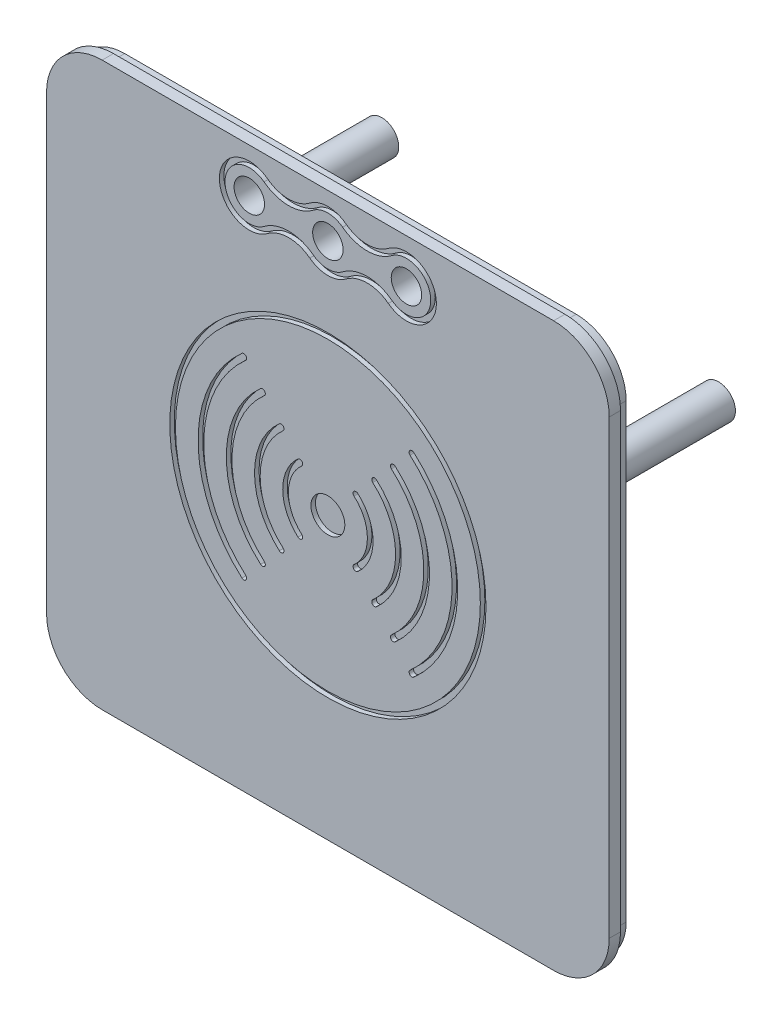
from build123d import *
from OCP.BRepFilletAPI import BRepFilletAPI_MakeChamfer

# Parameters (mm, degrees)
SALIENTE_EXTRUIR1_DEPTH = 2
SALIENTE_EXTRUIR2_DEPTH = 2
CORTAR_EXTRUIR1_DEPTH   = 2
CROQUIS5_R              = 28.015207884
CROQUIS5_R_2            = 27.015207884
CROQUIS5_R_3            = 3
CORTAR_EXTRUIR2_DEPTH   = 0.8
CROQUIS6_R              = 2.7
CORTAR_EXTRUIR3_DEPTH   = 11.8
CROQUIS7_R              = 3
SALIENTE_EXTRUIR3_DEPTH = 31.34
CROQUIS8_R              = 2
CORTAR_EXTRUIR4_DEPTH   = 5
CROQUIS9_W              = 20.569885585
CROQUIS9_H              = 2.86791674
CORTAR_EXTRUIR5_DEPTH   = 1
CROQUIS10_W             = 0.685574001
CROQUIS10_H             = 8.330017526
CROQUIS10_W_2           = 0.70136351
SALIENTE_EXTRUIR4_DEPTH = 1
CROQUIS11_W             = 1.000377771
CROQUIS11_H             = 8.330017526
SALIENTE_EXTRUIR5_DEPTH = 0.3
CROQUIS12_W             = 1.006924042
CROQUIS12_H             = 8.323274802
SALIENTE_EXTRUIR6_DEPTH = 0.5
CHAFL_N1_SIZE           = 0.310659094
CHAFL_N1_SIZE_2         = 0.3
CORTAR_EXTRUIR6_DEPTH   = 0.8


with BuildPart() as part:
    # Croquis1 → Saliente-Extruir1 (new body)
    with BuildSketch(Plane.XY):
        with BuildLine():
            Line((-24.066972173, 40), (-24.066972173, -40))
            ThreePointArc((-24.066972173, -40), (-21.181973968, -46.965001795), (-14.216972173, -49.85))
            Line((-14.216972173, -49.85), (65.783027827, -49.85))
            ThreePointArc((65.783027827, -49.85), (72.748029622, -46.965001795), (75.633027827, -40))
            Line((75.633027827, -40), (75.633027827, 40))
            ThreePointArc((75.633027827, 40), (72.748029622, 46.965001795), (65.783027827, 49.85))
            Line((65.783027827, 49.85), (-14.216972173, 49.85))
            ThreePointArc((-14.216972173, 49.85), (-21.181973968, 46.965001795), (-24.066972173, 40))
        make_face()
    extrude(amount=SALIENTE_EXTRUIR1_DEPTH)

    # Croquis2 → Saliente-Extruir2 (add)
    with BuildSketch(Plane(origin=(0, 0, 0), x_dir=(-1, 0, 0), z_dir=(0, 0, -1))):
        with BuildLine():
            Line((14.216972173, 48.85), (-65.783027827, 48.85))
            ThreePointArc((-65.783027827, 48.85), (-72.040922841, 46.257895014), (-74.633027827, 40))
            Line((-74.633027827, 40), (-74.633027827, -40))
            ThreePointArc((-74.633027827, -40), (-72.040922841, -46.257895014), (-65.783027827, -48.85))
            Line((-65.783027827, -48.85), (14.216972173, -48.85))
            ThreePointArc((14.216972173, -48.85), (20.474867186, -46.257895014), (23.066972173, -40))
            Line((23.066972173, -40), (23.066972173, 40))
            ThreePointArc((23.066972173, 40), (20.474867186, 46.257895014), (14.216972173, 48.85))
        make_face()
    extrude(amount=SALIENTE_EXTRUIR2_DEPTH)

    # Croquis3 → Cortar-Extruir1 (cut)
    with BuildSketch(Plane(origin=(0, 0, -2), x_dir=(-1, 0, 0), z_dir=(0, 0, -1))):
        Polygon((-5.783027827, 0), (-5.783027827, -40), (-45.783027827, -40), (-45.783027827, 0), (-45.783027827, 20.3), (-5.783027827, 20.3), align=None)
    extrude(amount=-CORTAR_EXTRUIR1_DEPTH, mode=Mode.SUBTRACT)

    # Croquis5 → Cortar-Extruir2 (cut)
    # profile 1 of 10: a face of its own
    with BuildSketch(Plane.XY.offset(2)):
        with Locations((25.783027827, 0)):
            Circle(CROQUIS5_R)
        with Locations((25.783027827, 0)):
            Circle(CROQUIS5_R_2, mode=Mode.SUBTRACT)
    # profile 2 of 10: a face of its own
    with BuildSketch(Plane.XY.offset(2)):
        with Locations((25.783027827, 0)):
            Circle(CROQUIS5_R_3)
    # profile 3 of 10: a face of its own
    with BuildSketch(Plane.XY.offset(2)):
        with BuildLine():
            ThreePointArc((40.344100587, -16.491669415), (47.783027827, 0), (40.344100587, 16.491669415))
            ThreePointArc((40.344100587, 16.491669415), (40.30022339, 17.197413555), (41.00596753, 17.241290752))
            ThreePointArc((41.00596753, 17.241290752), (48.783027827, 0), (41.00596753, -17.241290752))
            ThreePointArc((41.00596753, -17.241290752), (40.30022339, -17.197413555), (40.344100587, -16.491669415))
        make_face()
    # profile 4 of 10: a face of its own
    with BuildSketch(Plane.XY.offset(2)):
        with BuildLine():
            ThreePointArc((37.034765869, -12.74356273), (42.783027827, 0), (37.034765869, 12.74356273))
            ThreePointArc((37.034765869, 12.74356273), (36.990888672, 13.44930687), (37.696632812, 13.493184067))
            ThreePointArc((37.696632812, 13.493184067), (43.783027827, 0), (37.696632812, -13.493184067))
            ThreePointArc((37.696632812, -13.493184067), (36.990888672, -13.44930687), (37.034765869, -12.74356273))
        make_face()
    # profile 5 of 10: a face of its own
    with BuildSketch(Plane.XY.offset(2)):
        with BuildLine():
            ThreePointArc((33.725431151, -8.995456045), (37.783027827, 0), (33.725431151, 8.995456045))
            ThreePointArc((33.725431151, 8.995456045), (33.681553954, 9.701200185), (34.387298094, 9.745077382))
            ThreePointArc((34.387298094, 9.745077382), (38.783027827, 0), (34.387298094, -9.745077382))
            ThreePointArc((34.387298094, -9.745077382), (33.681553954, -9.701200185), (33.725431151, -8.995456045))
        make_face()
    # profile 6 of 10: a face of its own
    with BuildSketch(Plane.XY.offset(2)):
        with BuildLine():
            ThreePointArc((30.416096432, -5.247349359), (32.783027827, 0), (30.416096432, 5.247349359))
            ThreePointArc((30.416096432, 5.247349359), (30.372219236, 5.9530935), (31.077963376, 5.996970696))
            ThreePointArc((31.077963376, 5.996970696), (33.783027827, 0), (31.077963376, -5.996970696))
            ThreePointArc((31.077963376, -5.996970696), (30.372219236, -5.9530935), (30.416096432, -5.247349359))
        make_face()
    # profile 7 of 10: a face of its own
    with BuildSketch(Plane.XY.offset(2)):
        with BuildLine():
            ThreePointArc((20.488092278, 5.996970696), (17.783027827, 0), (20.488092278, -5.996970696))
            ThreePointArc((20.488092278, -5.996970696), (21.193836419, -5.9530935), (21.149959222, -5.247349359))
            ThreePointArc((21.149959222, -5.247349359), (18.783027827, 0), (21.149959222, 5.247349359))
            ThreePointArc((21.149959222, 5.247349359), (21.193836419, 5.9530935), (20.488092278, 5.996970696))
        make_face()
    # profile 8 of 10: a face of its own
    with BuildSketch(Plane.XY.offset(2)):
        with BuildLine():
            ThreePointArc((17.17875756, 9.745077382), (12.783027827, 0), (17.17875756, -9.745077382))
            ThreePointArc((17.17875756, -9.745077382), (17.884501701, -9.701200185), (17.840624504, -8.995456045))
            ThreePointArc((17.840624504, -8.995456045), (13.783027827, 0), (17.840624504, 8.995456045))
            ThreePointArc((17.840624504, 8.995456045), (17.884501701, 9.701200185), (17.17875756, 9.745077382))
        make_face()
    # profile 9 of 10: a face of its own
    with BuildSketch(Plane.XY.offset(2)):
        with BuildLine():
            ThreePointArc((13.869422842, 13.493184067), (7.783027827, 0), (13.869422842, -13.493184067))
            ThreePointArc((13.869422842, -13.493184067), (14.575166983, -13.44930687), (14.531289786, -12.74356273))
            ThreePointArc((14.531289786, -12.74356273), (8.783027827, 0), (14.531289786, 12.74356273))
            ThreePointArc((14.531289786, 12.74356273), (14.575166983, 13.44930687), (13.869422842, 13.493184067))
        make_face()
    # profile 10 of 10: a face of its own
    with BuildSketch(Plane.XY.offset(2)):
        with BuildLine():
            ThreePointArc((10.560088124, 17.241290752), (2.783027827, 0), (10.560088124, -17.241290752))
            ThreePointArc((10.560088124, -17.241290752), (11.265832264, -17.197413555), (11.221955068, -16.491669415))
            ThreePointArc((11.221955068, -16.491669415), (3.783027827, 0), (11.221955068, 16.491669415))
            ThreePointArc((11.221955068, 16.491669415), (11.265832264, 17.197413555), (10.560088124, 17.241290752))
        make_face()
    extrude(amount=-CORTAR_EXTRUIR2_DEPTH, mode=Mode.SUBTRACT)

    # Croquis6 → Cortar-Extruir3 (cut)
    with BuildSketch(Plane.XY.offset(2)):
        with Locations((25.783027827, 42.084354259)):
            Circle(CROQUIS6_R)
        with Locations(Location((39.706644574, 42.084354259, 0), (0, 0, 180))):
            Circle(CROQUIS6_R)
        with Locations((11.859411081, 42.084354259)):
            Circle(CROQUIS6_R)
    extrude(amount=-CORTAR_EXTRUIR3_DEPTH, mode=Mode.SUBTRACT)

    # Croquis7 → Saliente-Extruir3 (add)
    with BuildSketch(Plane(origin=(0, 0, -2), x_dir=(-1, 0, 0), z_dir=(0, 0, -1))):
        with Locations(Location((2.62017868, -5.323274802, 0), (0, 0, 180))):
            Circle(CROQUIS7_R)
        with Locations(Location((-59.659023373, 16.754261366, 0), (0, 0, 180))):
            Circle(CROQUIS7_R)
        with Locations(Location((0, 27.466663807, 0), (0, 0, 180))):
            Circle(CROQUIS7_R)
    extrude(amount=SALIENTE_EXTRUIR3_DEPTH)

    # Croquis8 → Cortar-Extruir4 (cut)
    with BuildSketch(Plane(origin=(0, 0, -33.34), x_dir=(-1, 0, 0), z_dir=(0, 0, -1))):
        with Locations((2.62017868, -5.323274802)):
            Circle(CROQUIS8_R)
        with Locations((0, 27.466663807)):
            Circle(CROQUIS8_R)
        with Locations((-59.659023373, 16.754261366)):
            Circle(CROQUIS8_R)
    extrude(amount=-CORTAR_EXTRUIR4_DEPTH, mode=Mode.SUBTRACT)

    # Croquis9 → Cortar-Extruir5 (cut)
    with BuildSketch(Plane(origin=(0, 0, 0), x_dir=(-1, 0, 0), z_dir=(0, 0, -1))):
        with Locations((-25.751233426, -37.742845004)):
            Rectangle(CROQUIS9_W, CROQUIS9_H)
    extrude(amount=-CORTAR_EXTRUIR5_DEPTH, mode=Mode.SUBTRACT)

    # Croquis10 → Saliente-Extruir4 (add)
    with BuildSketch(Plane(origin=(0, 0, -2), x_dir=(-1, 0, 0), z_dir=(0, 0, -1))):
        with Locations((-5.440240827, -4.165008763)):
            Rectangle(CROQUIS10_W, CROQUIS10_H)
        with Locations((-46.133709582, -4.165008763)):
            Rectangle(CROQUIS10_W_2, CROQUIS10_H)
    extrude(amount=SALIENTE_EXTRUIR4_DEPTH)

    # Croquis11 → Saliente-Extruir5 (add)
    with BuildSketch(Plane(origin=(5.783027827, 0, 0), x_dir=(0, 0, -1), z_dir=(1, 0, 0))):
        with Locations((2.499811114, -4.165008763)):
            Rectangle(CROQUIS11_W, CROQUIS11_H)
    extrude(amount=SALIENTE_EXTRUIR5_DEPTH)

    # Croquis12 → Saliente-Extruir6 (add)
    with BuildSketch(Plane.ZY.offset(-45.783027827)):
        with Locations((-2.496537979, -4.161637401)):
            Rectangle(CROQUIS12_W, CROQUIS12_H)
    extrude(amount=SALIENTE_EXTRUIR6_DEPTH)

    # Chaflán1
    chafl_n1_edges_1 = [part.edges().sort_by_distance(p)[0] for p in [
        (45.283027827, -4.161637401, -1.993075958),
    ]]
    chafl_n1_side_1 = [part.faces().sort_by_distance(p)[0] for p in [
        (45.283027827, -4.161637401, -1.999075958),
    ]]
    chafl_n1_edges_2 = [part.edges().sort_by_distance(p)[0] for p in [
        (6.083027827, -4.165008763, -1.999622229),
    ]]
    chafl_n1_side_2 = [part.faces().sort_by_distance(p)[0] for p in [
        (6.077027827, -4.165008763, -1.999622229),
    ]]
    chafl_n1 = BRepFilletAPI_MakeChamfer(part.part.solid().wrapped)
    for e in chafl_n1_edges_1:
        chafl_n1.Add(CHAFL_N1_SIZE - 0.0001, CHAFL_N1_SIZE_2 - 0.0001, e.wrapped, chafl_n1_side_1[0].wrapped)
    for e in chafl_n1_edges_2:
        chafl_n1.Add(CHAFL_N1_SIZE_2 - 0.0001, CHAFL_N1_SIZE - 0.0001, e.wrapped, chafl_n1_side_2[0].wrapped)
    add(Compound.cast(chafl_n1.Shape()), mode=Mode.REPLACE)  # a hair under: the kernel refuses the full size

    # Croquis13 → Cortar-Extruir6 (cut)
    with BuildSketch(Plane.XY.offset(2)):
        with BuildLine():
            ThreePointArc((15.07431414, 37.867927159), (18.821219454, 39.133432517), (22.568124768, 37.867927159))
            ThreePointArc((22.568124768, 37.867927159), (25.783027827, 36.782103872), (28.997930887, 37.867927159))
            ThreePointArc((28.997930887, 37.867927159), (32.7448362, 39.133432517), (36.491741514, 37.867927159))
            ThreePointArc((36.491741514, 37.867927159), (45.008894961, 42.084354259), (36.491741514, 46.300781358))
            ThreePointArc((36.491741514, 46.300781358), (32.7448362, 45.035276001), (28.997930887, 46.300781358))
            ThreePointArc((28.997930887, 46.300781358), (25.783027827, 47.386604646), (22.568124768, 46.300781358))
            ThreePointArc((22.568124768, 46.300781358), (18.821219454, 45.035276001), (15.07431414, 46.300781358))
            ThreePointArc((15.07431414, 46.300781358), (6.557160693, 42.084354259), (15.07431414, 37.867927159))
        make_face()
        with BuildLine():
            ThreePointArc((14.467986105, 45.505566725), (7.557160693, 42.084354259), (14.467986105, 38.663141793))
            ThreePointArc((14.467986105, 38.663141793), (18.821219454, 40.133432517), (23.174452803, 38.663141793))
            ThreePointArc((23.174452803, 38.663141793), (25.783027827, 37.782103872), (28.391602851, 38.663141793))
            ThreePointArc((28.391602851, 38.663141793), (32.7448362, 40.133432517), (37.09806955, 38.663141793))
            ThreePointArc((37.09806955, 38.663141793), (44.008894961, 42.084354259), (37.09806955, 45.505566725))
            ThreePointArc((37.09806955, 45.505566725), (32.7448362, 44.035276001), (28.391602851, 45.505566725))
            ThreePointArc((28.391602851, 45.505566725), (25.783027827, 46.386604646), (23.174452803, 45.505566725))
            ThreePointArc((23.174452803, 45.505566725), (18.821219454, 44.035276001), (14.467986105, 45.505566725))
        make_face(mode=Mode.SUBTRACT)
    extrude(amount=-CORTAR_EXTRUIR6_DEPTH, mode=Mode.SUBTRACT)


solid = part.part
